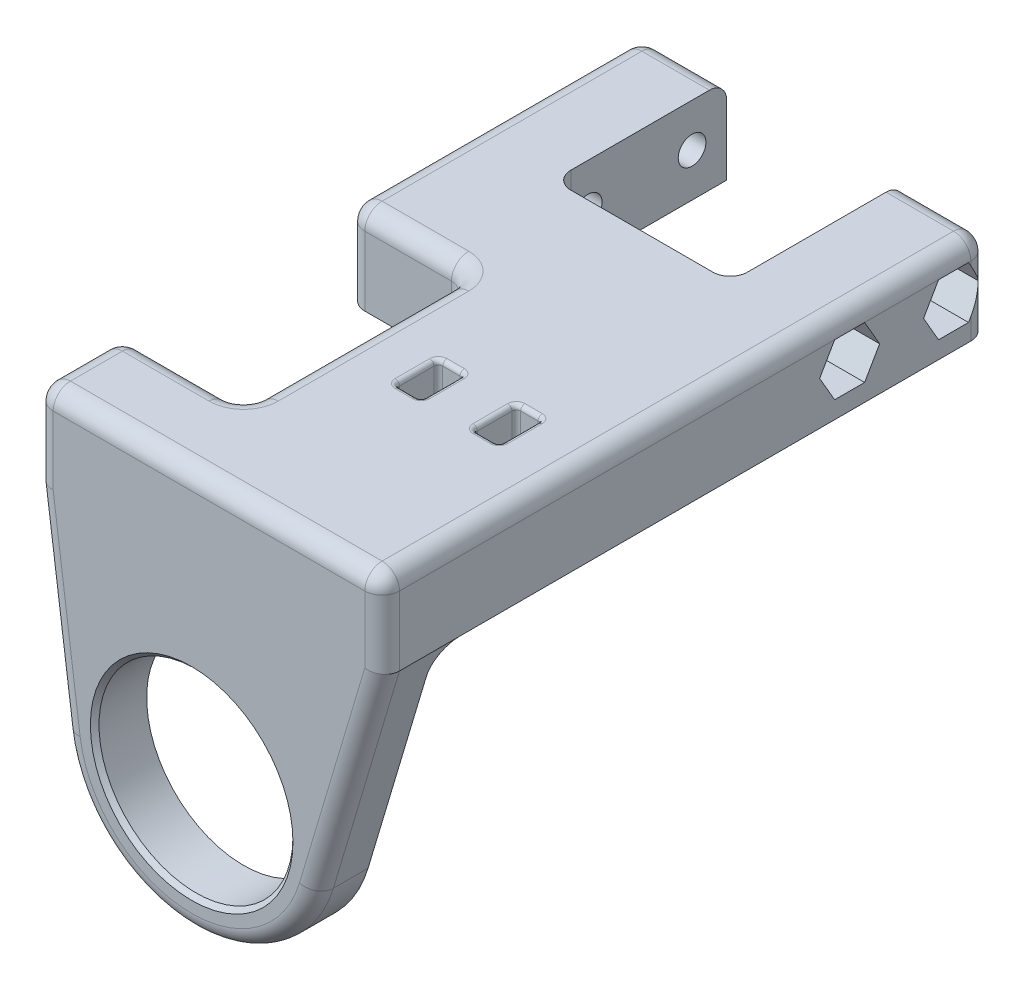
from build123d import *

# Parameters (mm, degrees)
BOSS_EXTRUDE1_DEPTH                                 = 6
SKETCH2_R                                           = 11.2
CUT_EXTRUDE1_DEPTH                                  = 39.685430074
SKETCH3_W                                           = 40
SKETCH3_H                                           = 10
BOSS_EXTRUDE2_DEPTH                                 = 44
SKETCH4_W                                           = 9.8
SKETCH4_H                                           = 10
BOSS_EXTRUDE3_DEPTH                                 = 20
FILLET1_R                                           = 3
CBORE_FOR_M3_HEX_SOCKET_HEAD_CAP_SCREW1_D           = 3.2
CBORE_FOR_M3_HEX_SOCKET_HEAD_CAP_SCREW1_CBORE_D     = 6.5
CBORE_FOR_M3_HEX_SOCKET_HEAD_CAP_SCREW1_CBORE_DEPTH = 3.4
CUT_EXTRUDE3_DEPTH                                  = 5.8
SKETCH9_W                                           = 14
SKETCH9_H                                           = 26
CUT_EXTRUDE4_DEPTH                                  = 82.969887764
FILLET2_R                                           = 2
FILLET3_R                                           = 2
FILLET4_R                                           = 2
FILLET5_R                                           = 2
CHAMFER1_SIZE                                       = 0.5
CUT_EXTRUDE5_REACH                                  = 83.97
SKETCH10_W                                          = 3
SKETCH10_H                                          = 5
FILLET6_R                                           = 0.5


with BuildPart() as part:
    # Sketch1 → Boss-Extrude1 (new body)
    with BuildSketch(Plane.XY):
        with BuildLine():
            Line((22, 31.25), (22, 21.25))
            Line((22, 21.25), (14.372872533, -4.291915093))
            ThreePointArc((14.372872533, -4.291915093), (-1.170294045, -14.954277376), (-14.865561141, -2.003769437))
            Line((-14.865561141, -2.003769437), (-18, 21.25))
            Line((-18, 21.25), (-18, 31.25))
            Line((-18, 31.25), (22, 31.25))
        make_face()
    extrude(amount=BOSS_EXTRUDE1_DEPTH)

    # Sketch2 → Cut-Extrude1 (cut, through all)
    with BuildSketch(Plane.XY.offset(6)):
        Circle(SKETCH2_R)
    extrude(amount=-CUT_EXTRUDE1_DEPTH, mode=Mode.SUBTRACT)

    # Sketch3 → Boss-Extrude2 (add)
    with BuildSketch(Plane(origin=(0, 0, 0), x_dir=(-1, 0, 0), z_dir=(0, 0, -1))):
        with Locations((-2, 26.25)):
            Rectangle(SKETCH3_W, SKETCH3_H)
    extrude(amount=BOSS_EXTRUDE2_DEPTH)

    # Sketch4 → Boss-Extrude3 (add)
    with BuildSketch(Plane(origin=(0, 0, -44), x_dir=(-1, 0, 0), z_dir=(0, 0, -1))):
        with Locations((-17.1, 26.25)):
            Rectangle(SKETCH4_W, SKETCH4_H)
        with Locations((13.1, 26.25)):
            Rectangle(SKETCH4_W, SKETCH4_H)
    extrude(amount=BOSS_EXTRUDE3_DEPTH)

    # Fillet1
    fillet1_edges = [part.edges().sort_by_distance(p)[0] for p in [
        (2, 21.25, 0),
    ]]
    fillet(fillet1_edges, radius=FILLET1_R)

    # CBORE for M3 Hex Socket Head Cap Screw1 (through all)
    with Locations(Plane.ZY.offset(18)):
        with Locations((-60, 26.25), (-48, 26.25)):
            CounterBoreHole(CBORE_FOR_M3_HEX_SOCKET_HEAD_CAP_SCREW1_D / 2, CBORE_FOR_M3_HEX_SOCKET_HEAD_CAP_SCREW1_CBORE_D / 2, CBORE_FOR_M3_HEX_SOCKET_HEAD_CAP_SCREW1_CBORE_DEPTH)

    # Sketch8 → Cut-Extrude3 (cut)
    with BuildSketch(Plane(origin=(22, 0, 0), x_dir=(0, 0, -1), z_dir=(1, 0, 0))):
        Polygon((49.732050808, 29.25), (46.267949192, 29.25), (44.535898385, 26.25), (46.267949192, 23.25), (49.732050808, 23.25), (51.464101615, 26.25), align=None)
        Polygon((58.267949192, 29.25), (56.535898385, 26.25), (58.267949192, 23.25), (61.732050808, 23.25), (63.464101615, 26.25), (61.732050808, 29.25), align=None)
    extrude(amount=-CUT_EXTRUDE3_DEPTH, mode=Mode.SUBTRACT)

    # Sketch9 → Cut-Extrude4 (cut, through all)
    with BuildSketch(Plane(origin=(0, 31.25, 0), x_dir=(1, 0, 0), z_dir=(0, 1, 0))):
        with Locations((-11, 17)):
            Rectangle(SKETCH9_W, SKETCH9_H)
    extrude(amount=-CUT_EXTRUDE4_DEPTH, mode=Mode.SUBTRACT)

    # Fillet2
    fillet2_edges = [part.edges().sort_by_distance(p)[0] for p in [
        (-4, 26.25, -30),
        (-4, 26.25, -4),
    ]]
    fillet(fillet2_edges, radius=FILLET2_R)

    # Fillet3
    fillet3_edges = [part.edges().sort_by_distance(p)[0] for p in [
        (12.2, 26.25, -44),
        (-8.2, 26.25, -44),
    ]]
    fillet(fillet3_edges, radius=FILLET3_R)

    # Fillet4
    # the kernel refuses this fillet: 2 mm, written as the material it takes off along each edge
    with BuildSketch(Plane(origin=(-14.865561141, -2.003769437, 6), x_dir=(0.9910374094124887, 0.13358462914940175, 0), z_dir=(-0.13358462914940175, 0.9910374094124889, 0))) as fillet4_piece_1:
        with BuildLine():
            CenterArc((FILLET4_R, FILLET4_R), FILLET4_R, 180, 90)
            Line((0, FILLET4_R), (0, 0))
            Line((0, 0), (FILLET4_R, 0))
        make_face()
    extrude(amount=28.464068275, mode=Mode.SUBTRACT)
    with BuildSketch(Plane(origin=(0, 0, 6), x_dir=(0.9581915021729206, -0.2861276728378469, 0), z_dir=(0.2861276728378469, 0.9581915021729206, 0))) as fillet4_piece_2:
        with BuildLine():
            CenterArc((15 - FILLET4_R, FILLET4_R), FILLET4_R, 270, 90)
            Line((15, FILLET4_R), (15, 0))
            Line((15, 0), (15 - FILLET4_R, 0))
        make_face()
    revolve(axis=Axis((0, 0, 6), (0, 0, -1)), revolution_arc=155.696949385, mode=Mode.SUBTRACT)
    with BuildSketch(Plane(origin=(23.430638364, 26.040957511, 6), x_dir=(0, 0, -1), z_dir=(-0.2861276728378473, -0.9581915021729205, 0))) as fillet4_piece_3:
        with BuildLine():
            CenterArc((FILLET4_R, -FILLET4_R), FILLET4_R, 90, 90)
            Line((0, -FILLET4_R), (0, 0))
            Line((0, 0), (FILLET4_R, 0))
        make_face()
    extrude(amount=31.656378224, mode=Mode.SUBTRACT)
    with BuildSketch(Plane(origin=(-18, 16.25, 6), x_dir=(0, 0, -1), z_dir=(0, 1, 0)), Plane(origin=(22, 36.25, 6), x_dir=(0, 0, -1), z_dir=(0, -1, 0))) as fillet4_piece_4:
        with BuildLine():
            CenterArc((FILLET4_R, -FILLET4_R), FILLET4_R, 90, 90)
            Line((0, -FILLET4_R), (0, 0))
            Line((0, 0), (FILLET4_R, 0))
        make_face()
    extrude(amount=20, mode=Mode.SUBTRACT)
    with BuildSketch(Plane(origin=(-18, 36.25, -4), x_dir=(1, 0, 0), z_dir=(0, -1, 0)), Plane(origin=(-18, 36.25, -30), x_dir=(0, 0, -1), z_dir=(0, -1, 0)), Plane(origin=(22, 16.25, -64), x_dir=(-1, 0, 0), z_dir=(0, 1, 0)), Plane(origin=(-18, 36.25, -64), x_dir=(1, 0, 0), z_dir=(0, -1, 0))) as fillet4_piece_5:
        with BuildLine():
            CenterArc((FILLET4_R, FILLET4_R), FILLET4_R, 180, 90)
            Line((0, FILLET4_R), (0, 0))
            Line((0, 0), (FILLET4_R, 0))
        make_face()
    extrude(amount=20, mode=Mode.SUBTRACT)

    # Fillet5
    # the kernel refuses this fillet: 2 mm, written as the material it takes off along each edge
    with BuildSketch(Plane(origin=(-4, 31.25, -28), x_dir=(0, -1, 0), z_dir=(0, 0, 1))) as fillet5_piece_1:
        with BuildLine():
            CenterArc((FILLET5_R, FILLET5_R), FILLET5_R, 180, 90)
            Line((0, FILLET5_R), (0, 0))
            Line((0, 0), (FILLET5_R, 0))
        make_face()
    extrude(amount=22, mode=Mode.SUBTRACT)
    with BuildSketch(Plane(origin=(-16, 31.25, -30), x_dir=(0, -1, 0), z_dir=(1, 0, 0)), Plane(origin=(-6, 31.25, -4), x_dir=(0, -1, 0), z_dir=(-1, 0, 0))) as fillet5_piece_2:
        with BuildLine():
            CenterArc((FILLET5_R, FILLET5_R), FILLET5_R, 180, 90)
            Line((0, FILLET5_R), (0, 0))
            Line((0, 0), (FILLET5_R, 0))
        make_face()
    extrude(amount=10, mode=Mode.SUBTRACT)
    with BuildSketch(Plane(origin=(-6, 31.25, -6), x_dir=(1, 0, 0), z_dir=(0, 0, -1))) as fillet5_piece_3:
        with BuildLine():
            CenterArc((2 + FILLET5_R, FILLET5_R), FILLET5_R, 180, 90)
            Line((2 + FILLET5_R, 0), (2, 0))
            Line((2, 0), (2, FILLET5_R))
        make_face()
    revolve(axis=Axis((-6, 31.25, -6), (0, -1, 0)), revolution_arc=90, mode=Mode.SUBTRACT)
    with BuildSketch(Plane(origin=(-6, 31.25, -28), x_dir=(0, 0, -1), z_dir=(-1, 0, 0))) as fillet5_piece_4:
        with BuildLine():
            CenterArc((2 + FILLET5_R, FILLET5_R), FILLET5_R, 180, 90)
            Line((2 + FILLET5_R, 0), (2, 0))
            Line((2, 0), (2, FILLET5_R))
        make_face()
    revolve(axis=Axis((-6, 31.25, -28), (0, -1, 0)), revolution_arc=90, mode=Mode.SUBTRACT)
    with BuildSketch(Plane(origin=(-16, 31.25, 6), x_dir=(0, 0, -1), z_dir=(1, 0, 0))) as fillet5_piece_5:
        with BuildLine():
            CenterArc((FILLET5_R, -FILLET5_R), FILLET5_R, 90, 90)
            Line((0, -FILLET5_R), (0, 0))
            Line((0, 0), (FILLET5_R, 0))
        make_face()
    extrude(amount=36, mode=Mode.SUBTRACT)
    with BuildSketch(Plane(origin=(-18, 31.25, -2), x_dir=(1, 0, 0), z_dir=(0, 0, 1))) as fillet5_piece_6:
        with BuildLine():
            CenterArc((FILLET5_R, -FILLET5_R), FILLET5_R, 90, 90)
            Line((0, -FILLET5_R), (0, 0))
            Line((0, 0), (FILLET5_R, 0))
        make_face()
    extrude(amount=6, mode=Mode.SUBTRACT)
    with BuildSketch(Plane(origin=(-18, 31.25, -62), x_dir=(0, -1, 0), z_dir=(0, 0, 1))) as fillet5_piece_7:
        with BuildLine():
            CenterArc((FILLET5_R, FILLET5_R), FILLET5_R, 180, 90)
            Line((0, FILLET5_R), (0, 0))
            Line((0, 0), (FILLET5_R, 0))
        make_face()
    extrude(amount=30, mode=Mode.SUBTRACT)
    with BuildSketch(Plane(origin=(22, 31.25, -62), x_dir=(0, -1, 0), z_dir=(0, 0, 1))) as fillet5_piece_8:
        with BuildLine():
            CenterArc((FILLET5_R, -FILLET5_R), FILLET5_R, 90, 90)
            Line((0, -FILLET5_R), (0, 0))
            Line((0, 0), (FILLET5_R, 0))
        make_face()
    extrude(amount=66, mode=Mode.SUBTRACT)
    with BuildSketch(Plane(origin=(-3.2, 31.25, -64), x_dir=(0, -1, 0), z_dir=(-1, 0, 0)), Plane(origin=(20, 31.25, -64), x_dir=(0, -1, 0), z_dir=(-1, 0, 0))) as fillet5_piece_9:
        with BuildLine():
            CenterArc((FILLET5_R, FILLET5_R), FILLET5_R, 180, 90)
            Line((0, FILLET5_R), (0, 0))
            Line((0, 0), (FILLET5_R, 0))
        make_face()
    extrude(amount=12.8, mode=Mode.SUBTRACT)
    with BuildSketch(Plane(origin=(-16, 31.25, -62), x_dir=(0, 0, -1), z_dir=(1, 0, 0))) as fillet5_piece_10:
        with BuildLine():
            CenterArc((2 - FILLET5_R, -FILLET5_R), FILLET5_R, 0, 90)
            Line((2 - FILLET5_R, 0), (2, 0))
            Line((2, 0), (2, -FILLET5_R))
        make_face()
    revolve(axis=Axis((-16, 31.25, -62), (0, 1, 0)), revolution_arc=90, mode=Mode.SUBTRACT)
    with BuildSketch(Plane(origin=(20, 31.25, -62), x_dir=(0, 0, -1), z_dir=(-1, 0, 0))) as fillet5_piece_11:
        with BuildLine():
            CenterArc((2 - FILLET5_R, FILLET5_R), FILLET5_R, 270, 90)
            Line((2 - FILLET5_R, 0), (2, 0))
            Line((2, 0), (2, FILLET5_R))
        make_face()
    revolve(axis=Axis((20, 31.25, -62), (0, -1, 0)), revolution_arc=90, mode=Mode.SUBTRACT)
    with BuildSketch(Plane(origin=(-16, 31.25, -32), x_dir=(-1, 0, 0), z_dir=(0, 0, -1))) as fillet5_piece_12:
        with BuildLine():
            CenterArc((2 - FILLET5_R, -FILLET5_R), FILLET5_R, 0, 90)
            Line((2 - FILLET5_R, 0), (2, 0))
            Line((2, 0), (2, -FILLET5_R))
        make_face()
    revolve(axis=Axis((-16, 31.25, -32), (0, 1, 0)), revolution_arc=90, mode=Mode.SUBTRACT)
    with BuildSketch(Plane(origin=(-16, 31.25, -2), x_dir=(0, 0, -1), z_dir=(1, 0, 0))) as fillet5_piece_13:
        with BuildLine():
            CenterArc((2 - FILLET5_R, -FILLET5_R), FILLET5_R, 0, 90)
            Line((2 - FILLET5_R, 0), (2, 0))
            Line((2, 0), (2, -FILLET5_R))
        make_face()
    revolve(axis=Axis((-16, 31.25, -2), (0, 1, 0)), revolution_arc=90, mode=Mode.SUBTRACT)
    with BuildSketch(Plane(origin=(20, 31.25, 4), x_dir=(0, 0, 1), z_dir=(-1, 0, 0))) as fillet5_piece_14:
        with BuildLine():
            CenterArc((2 - FILLET5_R, -FILLET5_R), FILLET5_R, 0, 90)
            Line((2, -FILLET5_R), (2, 0))
            Line((2, 0), (2 - FILLET5_R, 0))
        make_face()
    revolve(axis=Axis((20, 31.25, 4), (0, 1, 0)), revolution_arc=90, mode=Mode.SUBTRACT)
    with BuildSketch(Plane(origin=(-16, 31.25, 4), x_dir=(0, 0, 1), z_dir=(1, 0, 0))) as fillet5_piece_15:
        with BuildLine():
            CenterArc((2 - FILLET5_R, FILLET5_R), FILLET5_R, 270, 90)
            Line((2, FILLET5_R), (2, 0))
            Line((2, 0), (2 - FILLET5_R, 0))
        make_face()
    revolve(axis=Axis((-16, 31.25, 4), (0, -1, 0)), revolution_arc=90, mode=Mode.SUBTRACT)

    # Chamfer1
    chamfer1_edges = [part.edges().sort_by_distance(p)[0] for p in [
        (-11.2, 0, 6),
    ]]
    chamfer(chamfer1_edges, length=CHAMFER1_SIZE)

    # Sketch10 → Cut-Extrude5 (cut, up to next)
    with BuildSketch(Plane(origin=(0, 31.25, 0), x_dir=(1, 0, 0), z_dir=(0, 1, 0)), mode=Mode.PRIVATE) as cut_extrude5_sk1:
        with Locations((4.5, 17)):
            Rectangle(SKETCH10_W, SKETCH10_H)
    cut_extrude5_tool1 = extrude(cut_extrude5_sk1.sketch, amount=-CUT_EXTRUDE5_REACH, mode=Mode.PRIVATE) & part.part
    # Sketch10 → Cut-Extrude5 (cut, up to next)
    with BuildSketch(Plane(origin=(0, 31.25, 0), x_dir=(1, 0, 0), z_dir=(0, 1, 0)), mode=Mode.PRIVATE) as cut_extrude5_sk2:
        with Locations((13.5, 17)):
            Rectangle(SKETCH10_W, SKETCH10_H)
    cut_extrude5_tool2 = extrude(cut_extrude5_sk2.sketch, amount=-CUT_EXTRUDE5_REACH, mode=Mode.PRIVATE) & part.part
    add(cut_extrude5_tool1.solids().sort_by_distance((4.5, 31.25, -17))[0], mode=Mode.SUBTRACT)
    add(cut_extrude5_tool2.solids().sort_by_distance((13.5, 31.25, -17))[0], mode=Mode.SUBTRACT)

    # Fillet6
    fillet6_edges = [part.edges().sort_by_distance(p)[0] for p in [
        (3, 26.25, -14.5),
        (3, 26.25, -19.5),
        (6, 26.25, -19.5),
        (6, 26.25, -14.5),
        (3, 31.25, -17),
        (4.5, 31.25, -14.5),
        (6, 31.25, -17),
        (4.5, 31.25, -19.5),
        (4.5, 21.25, -14.5),
        (3, 21.25, -17),
        (4.5, 21.25, -19.5),
        (6, 21.25, -17),
        (12, 26.25, -19.5),
        (15, 26.25, -19.5),
        (15, 26.25, -14.5),
        (12, 26.25, -14.5),
        (13.5, 31.25, -19.5),
        (12, 31.25, -17),
        (13.5, 31.25, -14.5),
        (15, 31.25, -17),
        (12, 21.25, -17),
        (13.5, 21.25, -19.5),
        (15, 21.25, -17),
        (13.5, 21.25, -14.5),
    ]]
    fillet(fillet6_edges, radius=FILLET6_R)


solid = part.part
